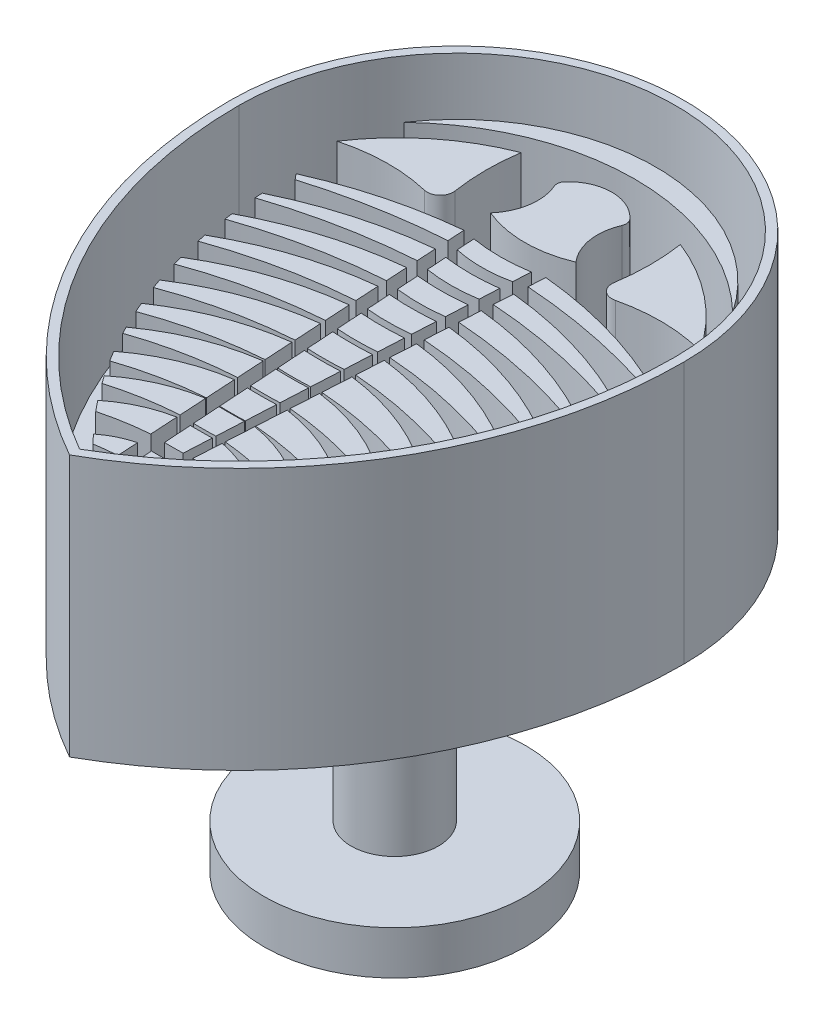
from build123d import *

# Parameters (mm, degrees)
P_IDAT_VYSUNUT_M1_DEPTH     = 3
P_IDAT_VYSUNUT_M2_DEPTH     = 2
VYSUNOUT_TENKOST_NN_1_DEPTH = 3
SKICA4_R                    = 1
P_IDAT_VYSUNUT_M3_DEPTH     = 5
SKICA5_R                    = 3
P_IDAT_VYSUNUT_M4_DEPTH     = 1


with BuildPart() as part:
    # Skica1 → Přidat vysunutím1 (new body)
    with BuildSketch(Plane(origin=(0, 0, 0), x_dir=(1, 0, 0), z_dir=(0, 1, 0))):
        with BuildLine():
            ThreePointArc((5, 0), (0, 5), (-5, 0))
            ThreePointArc((-5, 0), (-3.660254038, -5), (0, -8.660254038))
            ThreePointArc((0, -8.660254038), (3.660254038, -5), (5, 0))
        make_face()
    extrude(amount=-P_IDAT_VYSUNUT_M1_DEPTH)

    # Skica2 → Přidat vysunutím2 (add)
    with BuildSketch(Plane(origin=(0, 0, 0), x_dir=(1, 0, 0), z_dir=(0, 1, 0))):
        with BuildLine():
            Line((-0.916308941, 0.705415762), (-0.939566009, 1.094601969))
            ThreePointArc((-0.939566009, 1.094601969), (-2.496070066, 0.816540474), (-3.987598771, 0.291787966))
            ThreePointArc((-3.987598771, 0.291787966), (-3.93376434, 0.226933977), (-3.878875249, 0.162970131))
            ThreePointArc((-3.878875249, 0.162970131), (-2.412884098, 0.517710206), (-0.916308941, 0.705415762))
        make_face()
        with BuildLine():
            ThreePointArc((3.996049018, 0.288019105), (2.500543522, 0.815361092), (0.939566009, 1.094601969))
            Line((0.939566009, 1.094601969), (0.916308941, 0.705415762))
            ThreePointArc((0.916308941, 0.705415762), (2.474795846, 0.50622373), (3.999244676, 0.125941382))
            ThreePointArc((3.999244676, 0.125941382), (3.997959641, 0.206986411), (3.996049018, 0.288019105))
        make_face()
        with BuildLine():
            Line((-0.435047938, -7.348056278), (-0.463870567, -6.865735387))
            ThreePointArc((-0.463870567, -6.865735387), (-0.820283032, -6.998144282), (-1.142178643, -7.200493427))
            ThreePointArc((-1.142178643, -7.200493427), (-1.044053725, -7.303235817), (-0.944547646, -7.404641136))
            ThreePointArc((-0.944547646, -7.404641136), (-0.69047942, -7.370211218), (-0.435047938, -7.348056278))
        make_face()
        with BuildLine():
            Line((-0.48311443, -6.543706568), (-0.52103385, -5.909159033))
            ThreePointArc((-0.52103385, -5.909159033), (-1.175976189, -6.119175526), (-1.759961506, -6.482517714))
            ThreePointArc((-1.759961506, -6.482517714), (-1.662000146, -6.605433643), (-1.56220985, -6.726869431))
            ThreePointArc((-1.56220985, -6.726869431), (-1.026754601, -6.611177456), (-0.48311443, -6.543706568))
        make_face()
        with BuildLine():
            ThreePointArc((1.759961506, -6.482517714), (1.175976189, -6.119175526), (0.52103385, -5.909159033))
            Line((0.52103385, -5.909159033), (0.48311443, -6.543706568))
            ThreePointArc((0.48311443, -6.543706568), (1.026754601, -6.611177456), (1.56220985, -6.726869431))
            ThreePointArc((1.56220985, -6.726869431), (1.662000146, -6.605433643), (1.759961506, -6.482517714))
        make_face()
        with BuildLine():
            Line((-0.525801188, -5.829381897), (-0.563062791, -5.205842323))
            ThreePointArc((-0.563062791, -5.205842323), (-1.413947855, -5.458574562), (-2.173892527, -5.917228103))
            ThreePointArc((-2.173892527, -5.917228103), (-2.111177401, -6.008129807), (-2.04750967, -6.098366866))
            ThreePointArc((-2.04750967, -6.098366866), (-1.294271561, -5.920788208), (-0.525801188, -5.829381897))
        make_face()
        with BuildLine():
            Line((-0.564221505, -5.186452286), (-0.605000226, -4.504056891))
            ThreePointArc((-0.605000226, -4.504056891), (-1.630072172, -4.78948348), (-2.550516325, -5.323359302))
            ThreePointArc((-2.550516325, -5.323359302), (-2.47902439, -5.443080103), (-2.405948876, -5.561840938))
            ThreePointArc((-2.405948876, -5.561840938), (-1.496899189, -5.31618491), (-0.564221505, -5.186452286))
        make_face()
        with BuildLine():
            ThreePointArc((2.550516325, -5.323359302), (1.630072172, -4.78948348), (0.605000226, -4.504056891))
            Line((0.605000226, -4.504056891), (0.564221505, -5.186452286))
            ThreePointArc((0.564221505, -5.186452286), (1.496899189, -5.31618491), (2.405948876, -5.561840938))
            ThreePointArc((2.405948876, -5.561840938), (2.47902439, -5.443080103), (2.550516325, -5.323359302))
        make_face()
        with BuildLine():
            ThreePointArc((2.888337343, -4.702033808), (1.82385638, -4.112337163), (0.646885649, -3.803141834))
            Line((0.646885649, -3.803141834), (0.608773859, -4.440908528))
            ThreePointArc((0.608773859, -4.440908528), (1.70684421, -4.611105365), (2.77208347, -4.927318553))
            ThreePointArc((2.77208347, -4.927318553), (2.83089034, -4.815027047), (2.888337343, -4.702033808))
        make_face()
        with BuildLine():
            Line((-0.609681174, -4.425725417), (-0.646885649, -3.803141834))
            ThreePointArc((-0.646885649, -3.803141834), (-1.82385638, -4.112337163), (-2.888337343, -4.702033808))
            ThreePointArc((-2.888337343, -4.702033808), (-2.846957116, -4.783763443), (-2.804865412, -4.865128946))
            ThreePointArc((-2.804865412, -4.865128946), (-1.722246967, -4.57062129), (-0.609681174, -4.425725417))
        make_face()
        with BuildLine():
            Line((-0.649768137, -3.75490598), (-0.688738665, -3.102769081))
            ThreePointArc((-0.688738665, -3.102769081), (-1.994758332, -3.427574113), (-3.185571439, -4.054590719))
            ThreePointArc((-3.185571439, -4.054590719), (-3.137074616, -4.168548051), (-3.087237062, -4.281925446))
            ThreePointArc((-3.087237062, -4.281925446), (-1.886992142, -3.932901443), (-0.649768137, -3.75490598))
        make_face()
        with BuildLine():
            ThreePointArc((3.185571439, -4.054590719), (1.994758332, -3.427574113), (0.688738665, -3.102769081))
            Line((0.688738665, -3.102769081), (0.649768137, -3.75490598))
            ThreePointArc((0.649768137, -3.75490598), (1.886992142, -3.932901443), (3.087237062, -4.281925446))
            ThreePointArc((3.087237062, -4.281925446), (3.137074616, -4.168548051), (3.185571439, -4.054590719))
        make_face()
        with BuildLine():
            ThreePointArc((3.440254888, -3.38250392), (2.142176753, -2.735637699), (0.730570119, -2.40275715))
            Line((0.730570119, -2.40275715), (0.693500935, -3.023076761))
            ThreePointArc((0.693500935, -3.023076761), (2.048697762, -3.217851436), (3.362758833, -3.602219899))
            ThreePointArc((3.362758833, -3.602219899), (3.402116283, -3.492576859), (3.440254888, -3.38250392))
        make_face()
        with BuildLine():
            Line((-0.693500935, -3.023076761), (-0.730570119, -2.40275715))
            ThreePointArc((-0.730570119, -2.40275715), (-2.142176753, -2.735637699), (-3.440254888, -3.38250392))
            ThreePointArc((-3.440254888, -3.38250392), (-3.402116283, -3.492576859), (-3.362758833, -3.602219899))
            ThreePointArc((-3.362758833, -3.602219899), (-2.048697762, -3.217851436), (-0.693500935, -3.023076761))
        make_face()
        with BuildLine():
            Line((-0.737644723, -2.28436999), (-0.772386499, -1.70299746))
            ThreePointArc((-0.772386499, -1.70299746), (-2.265442062, -2.036978997), (-3.650276137, -2.687358247))
            ThreePointArc((-3.650276137, -2.687358247), (-3.621750205, -2.792878944), (-3.592127328, -2.898096962))
            ThreePointArc((-3.592127328, -2.898096962), (-2.186526172, -2.490583797), (-0.737644723, -2.28436999))
        make_face()
        with BuildLine():
            ThreePointArc((3.650276137, -2.687358247), (2.265442062, -2.036978997), (0.772386499, -1.70299746))
            Line((0.772386499, -1.70299746), (0.737644723, -2.28436999))
            ThreePointArc((0.737644723, -2.28436999), (2.186526172, -2.490583797), (3.592127328, -2.898096962))
            ThreePointArc((3.592127328, -2.898096962), (3.621750205, -2.792878944), (3.650276137, -2.687358247))
        make_face()
        with BuildLine():
            ThreePointArc((3.813377604, -1.970848141), (2.363805986, -1.33206045), (0.814191928, -1.003421043))
            Line((0.814191928, -1.003421043), (0.782080688, -1.540773892))
            ThreePointArc((0.782080688, -1.540773892), (2.299279672, -1.75301782), (3.773049464, -2.17127951))
            ThreePointArc((3.773049464, -2.17127951), (3.793701377, -2.071161983), (3.813377604, -1.970848141))
        make_face()
        with BuildLine():
            Line((-0.782080688, -1.540773892), (-0.814191928, -1.003421043))
            ThreePointArc((-0.814191928, -1.003421043), (-2.363805986, -1.33206045), (-3.813377604, -1.970848141))
            ThreePointArc((-3.813377604, -1.970848141), (-3.793701377, -2.071161983), (-3.773049464, -2.17127951))
            ThreePointArc((-3.773049464, -2.17127951), (-2.299279672, -1.75301782), (-0.782080688, -1.540773892))
        make_face()
        with BuildLine():
            Line((-0.826716789, -0.793828702), (-0.855989148, -0.303981988))
            ThreePointArc((-0.855989148, -0.303981988), (-2.436429093, -0.621360254), (-3.927142449, -1.234787575))
            ThreePointArc((-3.927142449, -1.234787575), (-3.915520245, -1.329262214), (-3.903042076, -1.423627611))
            ThreePointArc((-3.903042076, -1.423627611), (-2.385752794, -1.006769816), (-0.826716789, -0.793828702))
        make_face()
        with BuildLine():
            ThreePointArc((3.927142449, -1.234787575), (2.436429093, -0.621360254), (0.855989148, -0.303981988))
            Line((0.855989148, -0.303981988), (0.826716789, -0.793828702))
            ThreePointArc((0.826716789, -0.793828702), (2.385752794, -1.006769816), (3.903042076, -1.423627611))
            ThreePointArc((3.903042076, -1.423627611), (3.915520245, -1.329262214), (3.927142449, -1.234787575))
        make_face()
        with BuildLine():
            ThreePointArc((3.988971171, -0.481127617), (2.482365461, 0.094622416), (0.897780057, 0.395351462))
            Line((0.897780057, 0.395351462), (0.871479662, -0.044762094))
            ThreePointArc((0.871479662, -0.044762094), (2.444698783, -0.253257558), (3.979415358, -0.657155804))
            ThreePointArc((3.979415358, -0.657155804), (3.984562694, -0.569161766), (3.988971171, -0.481127617))
        make_face()
        with BuildLine():
            Line((-0.871479662, -0.044762094), (-0.897780057, 0.395351462))
            ThreePointArc((-0.897780057, 0.395351462), (-2.482365461, 0.094622416), (-3.988971171, -0.481127617))
            ThreePointArc((-3.988971171, -0.481127617), (-3.984562694, -0.569161766), (-3.979415358, -0.657155804))
            ThreePointArc((-3.979415358, -0.657155804), (-2.444698783, -0.253257558), (-0.871479662, -0.044762094))
        make_face()
        with BuildLine():
            ThreePointArc((1.142178643, -7.200493427), (0.820283032, -6.998144282), (0.463870567, -6.865735387))
            Line((0.463870567, -6.865735387), (0.434044566, -7.364846815))
            ThreePointArc((0.434044566, -7.364846815), (0.674611597, -7.394792085), (0.913565558, -7.435660409))
            ThreePointArc((0.913565558, -7.435660409), (1.028790357, -7.318969583), (1.142178643, -7.200493427))
        make_face()
        with BuildLine():
            ThreePointArc((2.173892527, -5.917228103), (1.413947855, -5.458574562), (0.563062791, -5.205842323))
            Line((0.563062791, -5.205842323), (0.524857999, -5.84516532))
            ThreePointArc((0.524857999, -5.84516532), (1.275900679, -5.956649098), (2.009972467, -6.150639692))
            ThreePointArc((2.009972467, -6.150639692), (2.092725079, -6.034490511), (2.173892527, -5.917228103))
        make_face()
        with BuildLine():
            ThreePointArc((0.662066926, 1.038108349), (0.004161666, 0.983172801), (-0.653856014, 1.036744977))
            Line((-0.653856014, 1.036744977), (-0.627177875, 0.627948759))
            ThreePointArc((-0.627177875, 0.627948759), (0.007047348, 0.561342071), (0.640951077, 0.630941981))
            Line((0.640951077, 0.630941981), (0.662066926, 1.038108349))
        make_face()
        with BuildLine():
            ThreePointArc((0.626415299, 0.350655846), (0.008819368, 0.30865484), (-0.608930115, 0.348333492))
            Line((-0.608930115, 0.348333492), (-0.579458539, -0.103267301))
            ThreePointArc((-0.579458539, -0.103267301), (0.011961322, -0.148953749), (0.60307309, -0.099440312))
            Line((0.60307309, -0.099440312), (0.626415299, 0.350655846))
        make_face()
        with BuildLine():
            Line((0.56489573, -0.835595287), (0.590594924, -0.34005056))
            ThreePointArc((0.590594924, -0.34005056), (0.013466822, -0.372593507), (-0.563817169, -0.342944183))
            Line((-0.563817169, -0.342944183), (-0.531393318, -0.839783468))
            ThreePointArc((-0.531393318, -0.839783468), (0.016881591, -0.871818687), (0.56489573, -0.835595287))
        make_face()
        with BuildLine():
            Line((0.526626446, -1.573522766), (0.554661515, -1.032936542))
            ThreePointArc((0.554661515, -1.032936542), (0.018112597, -1.058353296), (-0.518578705, -1.036145198))
            Line((-0.518578705, -1.036145198), (-0.483230171, -1.577800173))
            ThreePointArc((-0.483230171, -1.577800173), (0.021803285, -1.600485761), (0.526626446, -1.573522766))
        make_face()
        with BuildLine():
            ThreePointArc((0.518646873, -1.727388889), (0.022760192, -1.747313378), (-0.473249622, -1.730734777))
            Line((-0.473249622, -1.730734777), (-0.435139253, -2.3147101))
            ThreePointArc((-0.435139253, -2.3147101), (0.026715844, -2.330778107), (0.488405798, -2.310512426))
            Line((0.488405798, -2.310512426), (0.518646873, -1.727388889))
        make_face()
        with BuildLine():
            ThreePointArc((0.482569539, -2.423050098), (0.027411133, -2.438668883), (-0.42785002, -2.42640495))
            Line((-0.42785002, -2.42640495), (-0.387270501, -3.048215708))
            ThreePointArc((-0.387270501, -3.048215708), (0.031606302, -3.059500446), (0.45035596, -3.044208443))
            Line((0.45035596, -3.044208443), (0.482569539, -2.423050098))
        make_face()
        with BuildLine():
            ThreePointArc((0.410261069, -3.817338207), (0.036726185, -3.826801141), (-0.336874511, -3.820446857))
            Line((-0.336874511, -3.820446857), (-0.296212988, -4.443514195))
            ThreePointArc((-0.296212988, -4.443514195), (0.040912963, -4.448897986), (0.377966169, -4.440064623))
            Line((0.377966169, -4.440064623), (0.410261069, -3.817338207))
        make_face()
        with BuildLine():
            Line((0.412605163, -3.77213821), (0.446439681, -3.119724092))
            ThreePointArc((0.446439681, -3.119724092), (0.032066228, -3.131924709), (-0.382390558, -3.122992379))
            Line((-0.382390558, -3.122992379), (-0.339782943, -3.775880184))
            ThreePointArc((-0.339782943, -3.775880184), (0.036459149, -3.783668202), (0.412605163, -3.77213821))
        make_face()
        with BuildLine():
            Line((0.305409141, -5.839145549), (0.337737111, -5.215781462))
            ThreePointArc((0.337737111, -5.215781462), (0.046065788, -5.221258982), (-0.245643058, -5.218410675))
            Line((-0.245643058, -5.218410675), (-0.20495555, -5.841876176))
            ThreePointArc((-0.20495555, -5.841876176), (0.050245349, -5.843978529), (0.305409141, -5.839145549))
        make_face()
        with BuildLine():
            Line((0.338653865, -5.198104154), (0.374030936, -4.51594575))
            ThreePointArc((0.374030936, -4.51594575), (0.041392047, -4.523203734), (-0.291297367, -4.51883756))
            Line((-0.291297367, -4.51883756), (-0.246767591, -5.20117915))
            ThreePointArc((-0.246767591, -5.20117915), (0.045968856, -5.204538098), (0.338653865, -5.198104154))
        make_face()
        with BuildLine():
            ThreePointArc((0.301348943, -5.917436324), (0.050751597, -5.92147661), (-0.199872475, -5.919765477))
            Line((-0.199872475, -5.919765477), (-0.158480757, -6.55402178))
            ThreePointArc((-0.158480757, -6.55402178), (0.054999827, -6.555115225), (0.268455851, -6.551697388))
            Line((0.268455851, -6.551697388), (0.301348943, -5.917436324))
        make_face()
        with BuildLine():
            ThreePointArc((0.251838147, -6.872128272), (0.057127362, -6.874661622), (-0.137598784, -6.8740018))
            Line((-0.137598784, -6.8740018), (-0.106128968, -7.356222162))
            ThreePointArc((-0.106128968, -7.356222162), (0.060356742, -7.356571612), (0.226828381, -7.354379088))
            Line((0.226828381, -7.354379088), (0.251838147, -6.872128272))
        make_face()
        with BuildLine():
            ThreePointArc((-3.772330851, 2.547069838), (0, 4.070537807), (3.772330851, 2.547069838))
            ThreePointArc((3.772330851, 2.547069838), (0, 4.5517079), (-3.772330851, 2.547069838))
        make_face()
        with BuildLine():
            ThreePointArc((-1.822084639, 1.775573316), (-1.881947184, 2.534148909), (-1.826006026, 3.293023761))
            ThreePointArc((-1.826006026, 3.293023761), (-3.13913069, 2.530148747), (-4.162667451, 1.408254291))
            ThreePointArc((-4.162667451, 1.408254291), (-3.177280617, 1.546631075), (-2.188227529, 1.437501174))
            ThreePointArc((-2.188227529, 1.437501174), (-1.914977273, 1.508870723), (-1.822084639, 1.775573316))
        make_face()
        with BuildLine():
            ThreePointArc((2.188227529, 1.437501174), (3.177280617, 1.546631075), (4.162667451, 1.408254291))
            ThreePointArc((4.162667451, 1.408254291), (3.13913069, 2.530148747), (1.826006026, 3.293023761))
            ThreePointArc((1.826006026, 3.293023761), (1.881947184, 2.534148909), (1.822084639, 1.775573316))
            ThreePointArc((1.822084639, 1.775573316), (1.914977273, 1.508870723), (2.188227529, 1.437501174))
        make_face()
        with BuildLine():
            ThreePointArc((-0.777989506, 3.004550275), (-0.696842448, 2.345663458), (-0.978400549, 1.744463226))
            ThreePointArc((-0.978400549, 1.744463226), (0, 1.547069838), (0.978400549, 1.744463226))
            ThreePointArc((0.978400549, 1.744463226), (0.696842448, 2.345663458), (0.777989506, 3.004550275))
            ThreePointArc((0.777989506, 3.004550275), (0.791260451, 3.115919535), (0.7424957, 3.216920669))
            ThreePointArc((0.7424957, 3.216920669), (0, 3.547069838), (-0.7424957, 3.216920669))
            ThreePointArc((-0.7424957, 3.216920669), (-0.791260451, 3.115919535), (-0.777989506, 3.004550275))
        make_face()
    extrude(amount=P_IDAT_VYSUNUT_M2_DEPTH)



with BuildPart() as body_2:
    # Skica1<2> → Vysunout tenkostěnný1 (new, symmetric)
    with BuildSketch(Plane(origin=(0, 0, 0), x_dir=(1, 0, 0), z_dir=(0, 1, 0))):
        with BuildLine():
            ThreePointArc((5.2, 0), (0, 5.2), (-5.2, 0))
            ThreePointArc((-5.2, 0), (-3.804544281, -5.149757276), (0, -8.890444308))
            ThreePointArc((0, -8.890444308), (3.804544281, -5.149757276), (5.2, 0))
        make_face()
        with BuildLine():
            ThreePointArc((5, 0), (0, 5), (-5, 0))
            ThreePointArc((-5, 0), (-3.660254038, -5), (0, -8.660254038))
            ThreePointArc((0, -8.660254038), (3.660254038, -5), (5, 0))
        make_face(mode=Mode.SUBTRACT)
    extrude(amount=VYSUNOUT_TENKOST_NN_1_DEPTH, both=True)


with BuildPart() as part_1:
    add(part.part)

    add(body_2.part)  # Přidat vysunutím3 merges body 2
    # Skica4 → Přidat vysunutím3 (add)
    with BuildSketch(Plane(origin=(0, -3, 0), x_dir=(-1, 0, 0), z_dir=(0, -1, 0))):
        with Locations((0, -1.431655115)):
            Circle(SKICA4_R)
    extrude(amount=P_IDAT_VYSUNUT_M3_DEPTH)

    # Skica5 → Přidat vysunutím4 (add)
    with BuildSketch(Plane(origin=(0, -8, 0), x_dir=(-1, 0, 0), z_dir=(0, -1, 0))):
        with Locations((0, -1.431655115)):
            Circle(SKICA5_R)
    extrude(amount=P_IDAT_VYSUNUT_M4_DEPTH)


solid = part_1.part
